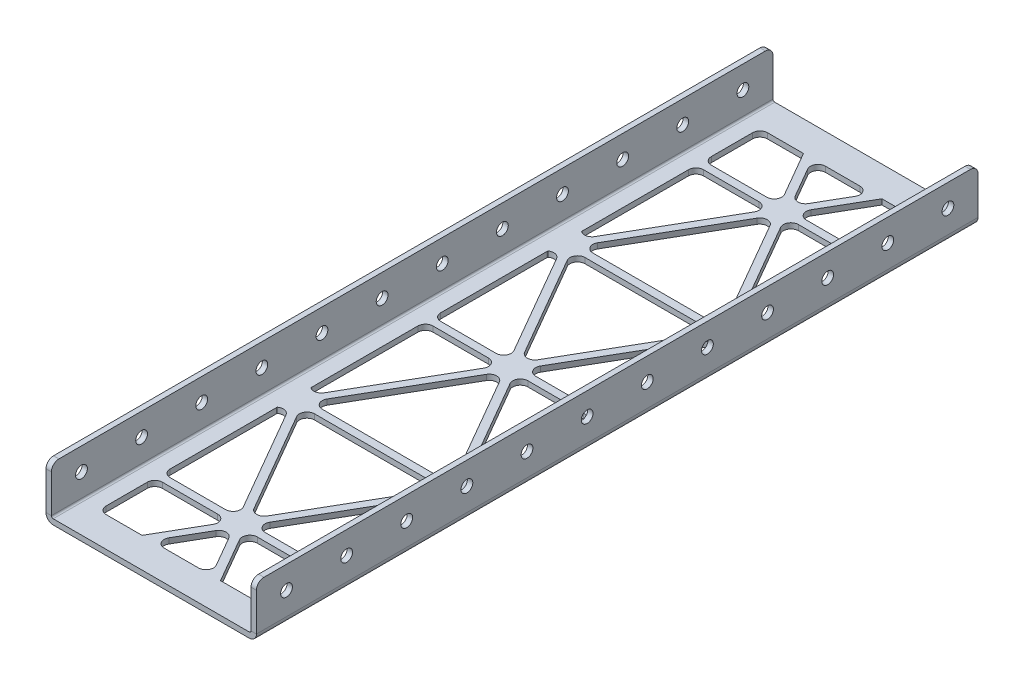
from build123d import *

# Parameters (mm, degrees)
BASE_FLANGE1_START             = -2.286
BASE_FLANGE1_OUTLINE_W         = 88.9
BASE_FLANGE1_OUTLINE_H         = 304.8
BASE_FLANGE1_DEPTH             = 2.286
EDGE_FLANGE1_STRIP_W           = 10.668
EDGE_FLANGE1_STRIP_H           = 2.286
EDGE_FLANGE1_STRIP_CUT_DEPTH   = 304.8
EDGE_FLANGE1_STRIP_2_W         = 10.668
EDGE_FLANGE1_STRIP_2_H         = 2.286
EDGE_FLANGE1_STRIP_CUT_2_DEPTH = 304.8
EDGE_FLANGE1_DEPTH             = 304.8
EDGE_FLANGE1_BEND_DEPTH        = 304.8
SKETCH22_R                     = 2.4892
CUT_EXTRUDE1_DEPTH             = 319.12546852
FILLET2_R                      = 3.175
CUT_EXTRUDE3_REACH             = 320.125
SKETCH25_W                     = 69.85
SKETCH25_H                     = 279.4
SKETCH2_W                      = 69.85
SKETCH2_H                      = 3.302
EXTRUDE_THIN1_DEPTH            = 2.286
SURFACECUT4_START              = -2.286
SURFACECUT4_DEPTH              = 2.286
FILLET4_R                      = 3.175


# Read off the part's stored shape, not the designer's step: Base-Flange1, SurfaceCut4
# Sheet-metal steps are written as plain solids
with BuildPart() as part:
    # Base-Flange1 outline → Base-Flange1 (new body)
    with BuildSketch(Plane(origin=(0, 0, 0), x_dir=(1, 0, 0), z_dir=(0, 1, 0)).offset(BASE_FLANGE1_START)):
        with Locations((44.45, 152.4)):
            Rectangle(BASE_FLANGE1_OUTLINE_W, BASE_FLANGE1_OUTLINE_H)
    extrude(amount=BASE_FLANGE1_DEPTH)

    # Edge-Flange1 strip (across the edge) → Edge-Flange1 strip cut (cut)
    with BuildSketch(Plane(origin=(88.9, 0, 0), x_dir=(-1, 0, 0), z_dir=(0, 0, -1))):
        with Locations((-2.286, -1.143)):
            Rectangle(EDGE_FLANGE1_STRIP_W, EDGE_FLANGE1_STRIP_H)
    extrude(amount=EDGE_FLANGE1_STRIP_CUT_DEPTH, mode=Mode.SUBTRACT)

    # Edge-Flange1 strip 2 (across the edge) → Edge-Flange1 strip cut 2 (cut)
    with BuildSketch(Plane.XY.offset(-304.8)):
        with Locations((-2.286, -1.143)):
            Rectangle(EDGE_FLANGE1_STRIP_2_W, EDGE_FLANGE1_STRIP_2_H)
    extrude(amount=EDGE_FLANGE1_STRIP_CUT_2_DEPTH, mode=Mode.SUBTRACT)

    # Edge-Flange1 section (across the edge) → Edge-Flange1 (add)
    with BuildSketch(Plane(origin=(88.9, 0, 0), x_dir=(-1, 0, 0), z_dir=(0, 0, -1))):
        with BuildLine():
            Line((0, 0.762), (0, 19.939))
            Line((0, 19.939), (2.286, 19.939))
            Line((2.286, 19.939), (2.286, 0.762))
            ThreePointArc((2.286, 0.762), (2.509184633, 0.223184633), (3.048, 0))
            Line((3.048, 0), (3.048, -2.286))
            ThreePointArc((3.048, -2.286), (0.892738531, -1.393261469), (0, 0.762))
        make_face()
    extrude(amount=EDGE_FLANGE1_DEPTH)

    # Edge-Flange1 section 2 (across the edge) → Edge-Flange1 bend (add)
    with BuildSketch(Plane.XY.offset(-304.8)):
        with BuildLine():
            Line((0, 0.762), (0, 19.939))
            Line((0, 19.939), (2.286, 19.939))
            Line((2.286, 19.939), (2.286, 0.762))
            ThreePointArc((2.286, 0.762), (2.509184633, 0.223184633), (3.048, 0))
            Line((3.048, 0), (3.048, -2.286))
            ThreePointArc((3.048, -2.286), (0.892738531, -1.393261469), (0, 0.762))
        make_face()
    extrude(amount=EDGE_FLANGE1_BEND_DEPTH)

    # Sketch22 → Cut-Extrude1 (cut, through all)
    with BuildSketch(Plane(origin=(88.9, 0, 0), x_dir=(0, 0, -1), z_dir=(1, 0, 0))):
        with Locations(Location((12.7, 10.414, 0), (0, 0, 90))):
            Circle(SKETCH22_R)
        with Locations(Location((38.1, 10.414, 0), (0, 0, 90))):
            Circle(SKETCH22_R)
        with Locations(Location((63.5, 10.414, 0), (0, 0, 90))):
            Circle(SKETCH22_R)
        with Locations(Location((88.9, 10.414, 0), (0, 0, 90))):
            Circle(SKETCH22_R)
        with Locations(Location((114.3, 10.414, 0), (0, 0, 90))):
            Circle(SKETCH22_R)
        with Locations(Location((139.7, 10.414, 0), (0, 0, 90))):
            Circle(SKETCH22_R)
        with Locations(Location((165.1, 10.414, 0), (0, 0, 90))):
            Circle(SKETCH22_R)
        with Locations(Location((190.5, 10.414, 0), (0, 0, 90))):
            Circle(SKETCH22_R)
        with Locations(Location((215.9, 10.414, 0), (0, 0, 90))):
            Circle(SKETCH22_R)
        with Locations(Location((241.3, 10.414, 0), (0, 0, 90))):
            Circle(SKETCH22_R)
        with Locations(Location((266.7, 10.414, 0), (0, 0, 90))):
            Circle(SKETCH22_R)
        with Locations(Location((292.1, 10.414, 0), (0, 0, 90))):
            Circle(SKETCH22_R)
        with Locations((317.5, 10.414)):
            Circle(SKETCH22_R)
        with Locations((342.9, 10.414)):
            Circle(SKETCH22_R)
        with Locations((368.3, 10.414)):
            Circle(SKETCH22_R)
        with Locations((393.7, 10.414)):
            Circle(SKETCH22_R)
    extrude(amount=-CUT_EXTRUDE1_DEPTH, mode=Mode.SUBTRACT)

    # Fillet2
    fillet2_edges = [part.edges().sort_by_distance(p)[0] for p in [
        (87.757, 19.939, 0),
        (87.757, 19.939, -304.8),
        (1.143, 19.939, -304.8),
        (1.143, 19.939, 0),
    ]]
    fillet(fillet2_edges, radius=FILLET2_R)

    # Sketch25 → Cut-Extrude3 (cut, up to next)
    with BuildSketch(Plane(origin=(0, 0, 0), x_dir=(1, 0, 0), z_dir=(0, 1, 0)), mode=Mode.PRIVATE) as cut_extrude3_sk1:
        with Locations((44.45, 152.4)):
            Rectangle(SKETCH25_W, SKETCH25_H)
    cut_extrude3_tool1 = extrude(cut_extrude3_sk1.sketch, amount=-CUT_EXTRUDE3_REACH, mode=Mode.PRIVATE) & part.part
    add(cut_extrude3_tool1.solids().sort_by_distance((44.45, 0, -152.4))[0], mode=Mode.SUBTRACT)

    # Sketch2 → Extrude-Thin1 (add)
    with BuildSketch(Plane(origin=(0, 0, 0), x_dir=(1, 0, 0), z_dir=(0, 1, 0))):
        with Locations((44.45, 152.4)):
            Rectangle(SKETCH2_W, SKETCH2_H)
        Polygon((4.094692058, 218.99544371), (81.945692058, 84.15355629), (84.805307942, 85.80455629), (6.954307942, 220.64644371), align=None)
        Polygon((6.954307942, 84.15355629), (84.805307942, 218.99544371), (81.945692058, 220.64644371), (4.094692058, 85.80455629), align=None)
        with Locations((44.45, 95.25)):
            Rectangle(SKETCH2_W, SKETCH2_H)
        with Locations((44.45, 38.1)):
            Rectangle(SKETCH2_W, SKETCH2_H)
        Polygon((4.094692058, 104.69544371), (81.945692058, -30.14644371), (84.805307942, -28.49544371), (6.954307942, 106.34644371), align=None)
        Polygon((6.954307942, -30.14644371), (84.805307942, 104.69544371), (81.945692058, 106.34644371), (4.094692058, -28.49544371), align=None)
        Polygon((4.094692058, 447.59544371), (81.945692058, 312.75355629), (84.805307942, 314.40455629), (6.954307942, 449.24644371), align=None)
        Polygon((6.954307942, 312.75355629), (84.805307942, 447.59544371), (81.945692058, 449.24644371), (4.094692058, 314.40455629), align=None)
        with Locations((44.45, 381)):
            Rectangle(SKETCH2_W, SKETCH2_H)
        with Locations((44.45, 323.85)):
            Rectangle(SKETCH2_W, SKETCH2_H)
        with Locations((44.45, -76.2)):
            Rectangle(SKETCH2_W, SKETCH2_H)
        Polygon((4.094692058, -9.60455629), (81.945692058, -144.44644371), (84.805307942, -142.79544371), (6.954307942, -7.95355629), align=None)
        Polygon((6.954307942, -144.44644371), (84.805307942, -9.60455629), (81.945692058, -7.95355629), (4.094692058, -142.79544371), align=None)
        with Locations((44.45, -133.35)):
            Rectangle(SKETCH2_W, SKETCH2_H)
        with Locations((44.45, -19.05)):
            Rectangle(SKETCH2_W, SKETCH2_H)
        Polygon((4.094692058, 333.29544371), (81.945692058, 198.45355629), (84.805307942, 200.10455629), (6.954307942, 334.94644371), align=None)
        Polygon((6.954307942, 198.45355629), (84.805307942, 333.29544371), (81.945692058, 334.94644371), (4.094692058, 200.10455629), align=None)
        with Locations((44.45, 266.7)):
            Rectangle(SKETCH2_W, SKETCH2_H)
        with Locations((44.45, 209.55)):
            Rectangle(SKETCH2_W, SKETCH2_H)
    extrude(amount=-EXTRUDE_THIN1_DEPTH)

    # SurfaceCut4 outline → SurfaceCut4 (cut)
    # profile 1 of 2: a face of its own
    with BuildSketch(Plane(origin=(0, 0, 0), x_dir=(1, 0, 0), z_dir=(0, 1, 0)).offset(SURFACECUT4_START)):
        Polygon((20.546544155, 0), (11.454432116, -15.748), (6.954307942, -7.95355629), (4.094692058, -9.60455629), (9.525, -19.010125546), (9.525, -19.089874454), (4.094692058, -28.49544371), (6.954307942, -30.14644371), (11.454432116, -22.352), (41.590384117, -74.549), (9.525, -74.549), (9.525, -77.851), (41.590384117, -77.851), (10.501226821, -131.699), (9.525, -131.699), (9.525, -133.389874454), (4.094692058, -142.79544371), (6.954307942, -144.44644371), (12.40763741, -135.001), (76.49236259, -135.001), (81.945692058, -144.44644371), (84.805307942, -142.79544371), (79.375, -133.389874454), (79.375, -131.699), (78.398773179, -131.699), (47.309615883, -77.851), (79.375, -77.851), (79.375, -74.549), (47.309615883, -74.549), (77.445567884, -22.352), (81.945692058, -30.14644371), (84.805307942, -28.49544371), (79.375, -19.089874454), (79.375, -19.010125546), (84.805307942, -9.60455629), (81.945692058, -7.95355629), (77.445567884, -15.748), (68.353455845, 0), (64.540634667, 0), (74.585952001, -17.399), (14.314047999, -17.399), (24.359365333, 0), align=None)
        Polygon((74.585952001, -131.699), (14.314047999, -131.699), (44.45, -79.502), align=None, mode=Mode.SUBTRACT)
        Polygon((44.45, -72.898), (14.314047999, -20.701), (74.585952001, -20.701), align=None, mode=Mode.SUBTRACT)
    # profile 2 of 2: a face of its own
    with BuildSketch(Plane(origin=(0, 0, 0), x_dir=(1, 0, 0), z_dir=(0, 1, 0)).offset(SURFACECUT4_START)):
        Polygon((81.945692058, 334.94644371), (77.445567884, 327.152), (47.309615883, 379.349), (79.375, 379.349), (79.375, 382.651), (47.309615883, 382.651), (84.805307942, 447.59544371), (81.945692058, 449.24644371), (44.45, 384.302), (6.954307942, 449.24644371), (4.094692058, 447.59544371), (41.590384117, 382.651), (9.525, 382.651), (9.525, 379.349), (41.590384117, 379.349), (11.454432116, 327.152), (6.954307942, 334.94644371), (4.094692058, 333.29544371), (9.525, 323.889874454), (9.525, 323.810125546), (4.094692058, 314.40455629), (6.954307942, 312.75355629), (11.454432116, 320.548), (20.546544155, 304.8), (24.359365333, 304.8), (14.314047999, 322.199), (74.585952001, 322.199), (64.540634667, 304.8), (68.353455845, 304.8), (77.445567884, 320.548), (81.945692058, 312.75355629), (84.805307942, 314.40455629), (79.375, 323.810125546), (79.375, 323.889874454), (84.805307942, 333.29544371), align=None)
        Polygon((74.585952001, 325.501), (14.314047999, 325.501), (44.45, 377.698), align=None, mode=Mode.SUBTRACT)
    extrude(amount=SURFACECUT4_DEPTH, mode=Mode.SUBTRACT)

    # Fillet4
    # the kernel refuses this fillet: 3.175 mm, written as the material it adds along each edge
    with BuildSketch(Plane(origin=(9.525, 0, -292.1), x_dir=(1, 0, 0), z_dir=(0, -1, 0)), Plane(origin=(79.375, 0, -154.051), x_dir=(-1, 0, 0), z_dir=(0, -1, 0)), Plane(origin=(79.375, 0, -268.351), x_dir=(-1, 0, 0), z_dir=(0, -1, 0)), Plane(origin=(79.375, 0, -39.751), x_dir=(-1, 0, 0), z_dir=(0, -1, 0)), Plane(origin=(9.525, 0, -12.7), x_dir=(0, 0, -1), z_dir=(0, -1, 0)), Plane(origin=(9.525, 0, -265.049), x_dir=(1, 0, 0), z_dir=(0, -1, 0)), Plane(origin=(9.525, 0, -150.749), x_dir=(1, 0, 0), z_dir=(0, -1, 0)), Plane(origin=(9.525, 0, -36.449), x_dir=(1, 0, 0), z_dir=(0, -1, 0)), Plane(origin=(9.525, 0, -268.351), x_dir=(0, 0, -1), z_dir=(0, -1, 0)), Plane(origin=(9.525, 0, -39.751), x_dir=(0, 0, -1), z_dir=(0, -1, 0)), Plane(origin=(9.525, 0, -154.051), x_dir=(0, 0, -1), z_dir=(0, -1, 0)), Plane(origin=(79.375, 0, -36.449), x_dir=(0, 0, 1), z_dir=(0, -1, 0))) as fillet4_piece_1:
        with BuildLine():
            CenterArc((FILLET4_R, FILLET4_R), FILLET4_R, 180, 90)
            Line((0, FILLET4_R), (0, 0))
            Line((0, 0), (FILLET4_R, 0))
        make_face()
    extrude(amount=2.286)
    with BuildSketch(Plane(origin=(79.375, 0, -202.906125546), x_dir=(-0.5000000000000177, 0, -0.8660254037844284), z_dir=(0, -1, 0)), Plane(origin=(79.375, 0, -88.606125546), x_dir=(-0.5000000000000177, 0, -0.8660254037844284), z_dir=(0, -1, 0)), Plane(origin=(79.375, -2.286, -216.193874454), x_dir=(-0.5000000000000032, 0, 0.8660254037844368), z_dir=(0, 1, 0)), Plane(origin=(79.375, -2.286, -101.893874454), x_dir=(-0.49999999999999073, 0, 0.866025403784444), z_dir=(0, 1, 0)), Plane(origin=(9.525, -2.286, -88.606125546), x_dir=(0.4999999999999798, 0, -0.8660254037844504), z_dir=(0, 1, 0)), Plane(origin=(9.525, -2.286, -202.906125546), x_dir=(0.49999999999998446, 0, -0.8660254037844476), z_dir=(0, 1, 0))) as fillet4_piece_2:
        with BuildLine():
            CenterArc((FILLET4_R * 0.267949192431, -FILLET4_R), FILLET4_R, 90, 30)
            Line((-FILLET4_R * 0.232050807569, -FILLET4_R * 0.133974596216), (0, 0))
            Line((0, 0), (FILLET4_R * 0.267949192431, 0))
        make_face()
    extrude(amount=2.286)
    with BuildSketch(Plane(origin=(14.314047999, -2.286, -96.901), x_dir=(0.49999999999999933, 0, -0.866025403784439), z_dir=(0, 1, 0)), Plane(origin=(14.314047999, -2.286, -211.201), x_dir=(0.5000000000000013, 0, -0.8660254037844378), z_dir=(0, 1, 0)), Plane(origin=(47.309615883, -2.286, -268.351), x_dir=(0.49999999999999817, 0, -0.8660254037844397), z_dir=(0, 1, 0)), Plane(origin=(74.585952001, -2.286, -207.899), x_dir=(-0.5000000000000001, 0, 0.8660254037844386), z_dir=(0, 1, 0)), Plane(origin=(31.691713751, -2.286, -12.7), x_dir=(0.49999999999999717, 0, -0.8660254037844403), z_dir=(0, 1, 0)), Plane(origin=(41.590384117, 0, -36.449), x_dir=(-1, 0, 0), z_dir=(0, -1, 0)), Plane(origin=(41.590384117, 0, -268.351), x_dir=(-0.4999999999999987, 0, -0.8660254037844394), z_dir=(0, -1, 0)), Plane(origin=(41.590384117, -2.286, -265.049), x_dir=(-0.49999999999999817, 0, 0.8660254037844397), z_dir=(0, 1, 0)), Plane(origin=(57.208286249, -2.286, -292.1), x_dir=(-0.4999999999999937, 0, 0.8660254037844424), z_dir=(0, 1, 0)), Plane(origin=(77.445567884, -2.286, -98.552), x_dir=(-0.4999999999999986, 0, -0.8660254037844394), z_dir=(0, 1, 0)), Plane(origin=(11.454432116, 0, -98.552), x_dir=(0.49999999999999895, 0, -0.8660254037844393), z_dir=(0, -1, 0)), Plane(origin=(11.454432116, -2.286, -206.248), x_dir=(0.4999999999999983, 0, 0.8660254037844396), z_dir=(0, 1, 0)), Plane(origin=(44.45, -2.286, -41.402), x_dir=(-0.49999999999999767, 0, -0.8660254037844399), z_dir=(0, 1, 0)), Plane(origin=(77.445567884, -2.286, -91.948), x_dir=(0.49999999999999756, 0, 0.8660254037844402), z_dir=(0, 1, 0)), Plane(origin=(47.309615883, -2.286, -36.449), x_dir=(1, 0, 0), z_dir=(0, 1, 0)), Plane(origin=(47.309615883, -2.286, -150.749), x_dir=(1, 0, 0), z_dir=(0, 1, 0))) as fillet4_piece_3:
        with BuildLine():
            CenterArc((FILLET4_R * 1.73205080757, -FILLET4_R), FILLET4_R, 90, 120)
            Line((FILLET4_R * 0.866025403784, -FILLET4_R * 1.5), (0, 0))
            Line((0, 0), (FILLET4_R * 1.73205080757, 0))
        make_face()
    extrude(amount=2.286)
    with BuildSketch(Plane(origin=(47.309615883, 0, -154.051), x_dir=(0.49999999999999717, 0, -0.8660254037844403), z_dir=(0, -1, 0)), Plane(origin=(47.309615883, 0, -39.751), x_dir=(0.49999999999999817, 0, -0.8660254037844397), z_dir=(0, -1, 0)), Plane(origin=(41.590384117, 0, -150.749), x_dir=(-0.49999999999999784, 0, 0.8660254037844399), z_dir=(0, -1, 0)), Plane(origin=(57.208286249, 0, -12.7), x_dir=(-1, 0, 0), z_dir=(0, -1, 0)), Plane(origin=(74.585952001, 0, -93.599), x_dir=(-0.49999999999999817, 0, 0.8660254037844397), z_dir=(0, -1, 0)), Plane(origin=(74.585952001, 0, -211.201), x_dir=(-1, 0, 0), z_dir=(0, -1, 0)), Plane(origin=(41.590384117, -2.286, -39.751), x_dir=(-0.4999999999999977, 0, -0.86602540378444), z_dir=(0, 1, 0)), Plane(origin=(74.585952001, 0, -96.901), x_dir=(-1, 0, 0), z_dir=(0, -1, 0)), Plane(origin=(41.590384117, -2.286, -154.051), x_dir=(-0.49999999999999817, 0, -0.8660254037844397), z_dir=(0, 1, 0)), Plane(origin=(31.691713751, 0, -292.1), x_dir=(1, 0, 0), z_dir=(0, -1, 0)), Plane(origin=(77.445567884, 0, -206.248), x_dir=(0.4999999999999937, 0, 0.8660254037844424), z_dir=(0, -1, 0)), Plane(origin=(44.45, -2.286, -149.098), x_dir=(-0.49999999999999784, 0, 0.8660254037844399), z_dir=(0, 1, 0)), Plane(origin=(44.45, -2.286, -155.702), x_dir=(0.4999999999999991, 0, -0.8660254037844392), z_dir=(0, 1, 0)), Plane(origin=(11.454432116, 0, -91.948), x_dir=(0.49999999999999856, 0, 0.8660254037844396), z_dir=(0, -1, 0)), Plane(origin=(44.45, -2.286, -34.798), x_dir=(-0.49999999999999895, 0, 0.8660254037844393), z_dir=(0, 1, 0)), Plane(origin=(11.454432116, -2.286, -212.852), x_dir=(0.5, 0, -0.8660254037844386), z_dir=(0, 1, 0)), Plane(origin=(44.45, -2.286, -270.002), x_dir=(0.500000000000004, 0, -0.8660254037844364), z_dir=(0, 1, 0)), Plane(origin=(77.445567884, 0, -212.852), x_dir=(-0.4999999999999956, 0, -0.8660254037844413), z_dir=(0, -1, 0)), Plane(origin=(44.45, -2.286, -263.398), x_dir=(-0.49999999999999756, 0, 0.8660254037844402), z_dir=(0, 1, 0)), Plane(origin=(47.309615883, 0, -265.049), x_dir=(1, 0, 0), z_dir=(0, -1, 0)), Plane(origin=(14.314047999, 0, -207.899), x_dir=(1, 0, 0), z_dir=(0, -1, 0)), Plane(origin=(14.314047999, -2.286, -93.599), x_dir=(0.4999999999999984, 0, 0.8660254037844396), z_dir=(0, 1, 0))) as fillet4_piece_4:
        with BuildLine():
            CenterArc((FILLET4_R * 1.73205080757, FILLET4_R), FILLET4_R, 150, 120)
            Line((FILLET4_R * 0.866025403784, FILLET4_R * 1.5), (0, 0))
            Line((0, 0), (FILLET4_R * 1.73205080757, 0))
        make_face()
    extrude(amount=2.286)
    with BuildSketch(Plane(origin=(9.525, 0, -216.193874454), x_dir=(0, 0, -1), z_dir=(0, -1, 0)), Plane(origin=(9.525, 0, -101.893874454), x_dir=(0, 0, -1), z_dir=(0, -1, 0))) as fillet4_piece_5:
        with BuildLine():
            CenterArc((FILLET4_R * 0.267949192431, FILLET4_R), FILLET4_R, 240, 30)
            Line((-FILLET4_R * 0.232050807569, FILLET4_R * 0.133974596216), (0, 0))
            Line((0, 0), (FILLET4_R * 0.267949192431, 0))
        make_face()
    extrude(amount=2.286)
    with BuildSketch(Plane(origin=(79.375, 0, -292.1), x_dir=(-1, 0, 0), z_dir=(0, -1, 0)), Plane(origin=(79.375, 0, -12.7), x_dir=(0, 0, -1), z_dir=(0, -1, 0)), Plane(origin=(79.375, 0, -265.049), x_dir=(-1, 0, 0), z_dir=(0, -1, 0)), Plane(origin=(79.375, 0, -150.749), x_dir=(-1, 0, 0), z_dir=(0, -1, 0))) as fillet4_piece_6:
        with BuildLine():
            CenterArc((FILLET4_R, -FILLET4_R), FILLET4_R, 90, 90)
            Line((0, -FILLET4_R), (0, 0))
            Line((0, 0), (FILLET4_R, 0))
        make_face()
    extrude(amount=2.286)


solid = part.part
